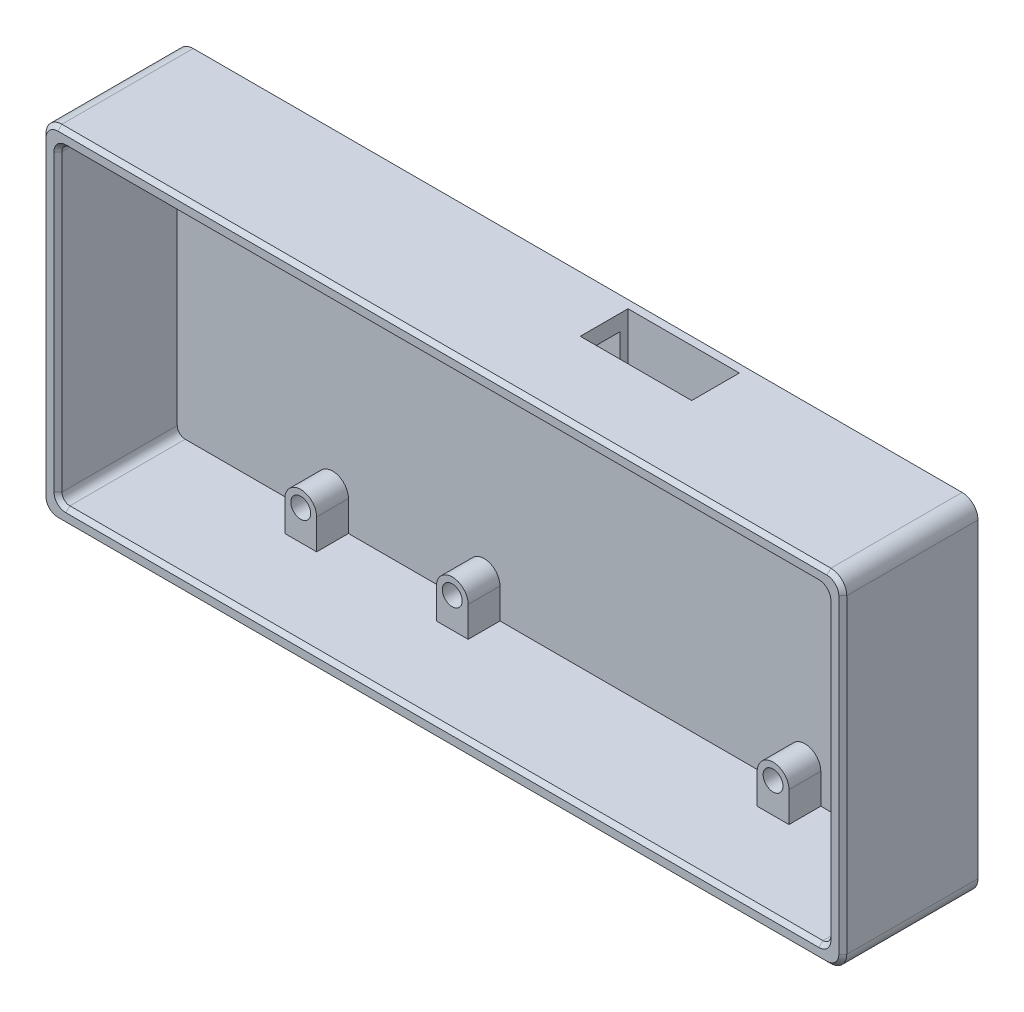
from build123d import *

# Parameters (mm, degrees)
EXTRUDE_1_DEPTH     = 2
SKETCH_2_W          = 10
SKETCH_2_H          = 10
CUT_EXTRUDE_1_DEPTH = 1
EXTRUDE_2_DEPTH     = 15
EXTRUDE_3_DEPTH     = 4
MM_2_D              = 2.5
MM_2_DEPTH          = 4
MM_2_TIP            = 0.751075774
SKETCH_9_W          = 14
SKETCH_9_H          = 6
CUT_EXTRUDE_2_DEPTH = 2
SKETCH_9_2_W        = 14
SKETCH_9_2_H        = 6
CUT_EXTRUDE_3_DEPTH = 10
CHAMFER_1_SIZE      = 0.5


with BuildPart() as part:
    # 草图1 → 凸台-拉伸1 (new body)
    with BuildSketch(Plane.XY):
        with BuildLine():
            Line((2.225416965, 43.522410124), (2.225416965, 4.474270124))
            ThreePointArc((2.225416965, 4.474270124), (2.811203402, 3.060056561), (4.225416965, 2.474270124))
            Line((4.225416965, 2.474270124), (100.900116965, 2.474270124))
            ThreePointArc((100.900116965, 2.474270124), (102.314330527, 3.060056561), (102.900116965, 4.474270124))
            Line((102.900116965, 4.474270124), (102.900116965, 43.522410124))
            ThreePointArc((102.900116965, 43.522410124), (102.314330527, 44.936623686), (100.900116965, 45.522410124))
            Line((100.900116965, 45.522410124), (4.225416965, 45.522410124))
            ThreePointArc((4.225416965, 45.522410124), (2.811203402, 44.936623686), (2.225416965, 43.522410124))
        make_face()
    extrude(amount=EXTRUDE_1_DEPTH)

    # 草图2 → 切除-拉伸1 (cut)
    with BuildSketch(Plane.XY.offset(2)):
        with Locations((66.900116965, 38.523360124)):
            Rectangle(SKETCH_2_W, SKETCH_2_H)
    extrude(amount=-CUT_EXTRUDE_1_DEPTH, mode=Mode.SUBTRACT)

    # 草图3 → 凸台-拉伸2 (add)
    with BuildSketch(Plane.XY.offset(2)):
        with BuildLine():
            Line((100.900116965, 45.522410124), (4.225416965, 45.522410124))
            ThreePointArc((4.225416965, 45.522410124), (2.811203402, 44.936623686), (2.225416965, 43.522410124))
            Line((2.225416965, 43.522410124), (2.225416965, 4.474270124))
            ThreePointArc((2.225416965, 4.474270124), (2.811203402, 3.060056561), (4.225416965, 2.474270124))
            Line((4.225416965, 2.474270124), (100.900116965, 2.474270124))
            ThreePointArc((100.900116965, 2.474270124), (102.314330527, 3.060056561), (102.900116965, 4.474270124))
            Line((102.900116965, 4.474270124), (102.900116965, 43.522410124))
            ThreePointArc((102.900116965, 43.522410124), (102.314330527, 44.936623686), (100.900116965, 45.522410124))
        make_face()
        with BuildLine():
            Line((99.900259554, 43.523360121), (85.135816842, 43.522660124))
            Line((85.135816842, 43.522660124), (81.135817087, 43.522660124))
            Line((81.135817087, 43.522660124), (44.800816842, 43.523360124))
            Line((44.800816842, 43.523360124), (40.800817087, 43.523360124))
            Line((40.800817087, 43.523360124), (25.750866842, 43.523360124))
            Line((25.750866842, 43.523360124), (21.750867087, 43.523360124))
            Line((21.750867087, 43.523360124), (5.225191965, 43.523360124))
            ThreePointArc((5.225191965, 43.523360124), (4.518078599, 43.23046032), (4.225191965, 42.5233415))
            Line((4.225191965, 42.5233415), (4.225881965, 5.474270124))
            ThreePointArc((4.225881965, 5.474270124), (4.518775184, 4.767163343), (5.225881965, 4.474270124))
            Line((5.225881965, 4.474270124), (21.750867087, 4.474270124))
            Line((21.750867087, 4.474270124), (25.750866842, 4.474270124))
            Line((25.750866842, 4.474270124), (40.800817087, 4.474270124))
            Line((40.800817087, 4.474270124), (44.800816842, 4.474270124))
            Line((44.800816842, 4.474270124), (81.135817087, 4.474270124))
            Line((81.135817087, 4.474270124), (85.135816842, 4.474270124))
            Line((85.135816842, 4.474270124), (99.899616965, 4.474270124))
            ThreePointArc((99.899616965, 4.474270124), (100.606717161, 4.767156758), (100.899616964, 5.4742515))
            Line((100.899616964, 5.4742515), (100.900306965, 42.523360124))
            ThreePointArc((100.900306965, 42.523360124), (100.607396983, 43.230483666), (99.900259554, 43.523360121))
        make_face(mode=Mode.SUBTRACT)
    extrude(amount=EXTRUDE_2_DEPTH)

    # 草图4 → 凸台-拉伸3 (add)
    with BuildSketch(Plane.XY.offset(2)):
        with BuildLine():
            Line((21.750867087, 39.723310124), (21.750867087, 43.523360124))
            Line((21.750867087, 43.523360124), (25.750866842, 43.523360124))
            Line((25.750866842, 43.523360124), (25.750866842, 39.722610124))
            ThreePointArc((25.750866842, 39.722610124), (23.750516904, 37.722610216), (21.750867087, 39.723310124))
        make_face()
        with BuildLine():
            Line((40.800817087, 39.722610124), (40.800817087, 43.523360124))
            Line((40.800817087, 43.523360124), (44.800816842, 43.523360124))
            Line((44.800816842, 43.523360124), (44.800816842, 39.721910124))
            ThreePointArc((44.800816842, 39.721910124), (42.800466904, 37.721910216), (40.800817087, 39.722610124))
        make_face()
        with BuildLine():
            Line((81.135817087, 39.722610124), (81.135817087, 43.522660124))
            Line((81.135817087, 43.522660124), (85.135816842, 43.522660124))
            Line((85.135816842, 43.522660124), (85.135816842, 39.721910124))
            ThreePointArc((85.135816842, 39.721910124), (83.135466904, 37.721910216), (81.135817087, 39.722610124))
        make_face()
        with BuildLine():
            Line((21.750867087, 8.273350124), (21.750867087, 4.474270124))
            Line((21.750867087, 4.474270124), (25.750866842, 4.474270124))
            Line((25.750866842, 4.474270124), (25.750866842, 8.272650124))
            ThreePointArc((25.750866842, 8.272650124), (23.751217026, 10.273350032), (21.750867087, 8.273350124))
        make_face()
        with BuildLine():
            Line((40.800817087, 8.272650124), (40.800817087, 4.474270124))
            Line((40.800817087, 4.474270124), (44.800816842, 4.474270124))
            Line((44.800816842, 4.474270124), (44.800816842, 8.271950124))
            ThreePointArc((44.800816842, 8.271950124), (42.801167026, 10.272650032), (40.800817087, 8.272650124))
        make_face()
        with BuildLine():
            Line((81.135817087, 8.273350124), (81.135817087, 4.474270124))
            Line((81.135817087, 4.474270124), (85.135816842, 4.474270124))
            Line((85.135816842, 4.474270124), (85.135816842, 8.272650124))
            ThreePointArc((85.135816842, 8.272650124), (83.136167026, 10.273350032), (81.135817087, 8.273350124))
        make_face()
    extrude(amount=EXTRUDE_3_DEPTH)

    # 大小mm 暗销孔2
    with Locations(Plane(origin=(23.750866904, 39.722610124, 6), x_dir=(1, 0, 0), z_dir=(0, 0, 1))):
        with Locations((0, 0), (19.04995, -0.0007), (59.38495, -0.0007), (59.384950122, -31.44926), (19.049950122, -31.44996), (1.22e-07, -31.44926)):
            Hole(MM_2_D / 2, depth=MM_2_DEPTH)
            with Locations((0, 0, -(MM_2_DEPTH + MM_2_TIP / 2))):  # 118° drill point
                Cone(0, MM_2_D / 2, MM_2_TIP, mode=Mode.SUBTRACT)

    # 草图9 → 切除-拉伸2 (cut)
    with BuildSketch(Plane(origin=(0, 45.522410124, 0), x_dir=(1, 0, 0), z_dir=(0, 1, 0))):
        with Locations((66.900116965, -4)):
            Rectangle(SKETCH_9_W, SKETCH_9_H)
    extrude(amount=-CUT_EXTRUDE_2_DEPTH, mode=Mode.SUBTRACT)

    # 草图9<2> → 切除-拉伸3 (cut)
    with BuildSketch(Plane(origin=(0, 45.522410124, 0), x_dir=(1, 0, 0), z_dir=(0, 1, 0))):
        with Locations((66.900116965, -4)):
            Rectangle(SKETCH_9_2_W, SKETCH_9_2_H)
    extrude(amount=-CUT_EXTRUDE_3_DEPTH, mode=Mode.SUBTRACT)

    # 倒角1
    chamfer_1_edges = [part.edges().sort_by_distance(p)[0] for p in [
        (83.135816965, 43.522660124, 17),
        (62.968316965, 43.523010124, 17),
        (25.013004404, 43.523360124, 17),
        (4.518078599, 43.23046032, 17),
        (4.225536965, 23.998805812, 17),
        (4.518775184, 4.767163343, 17),
        (52.562749465, 4.474270124, 17),
        (100.606717161, 4.767156758, 17),
        (100.899961965, 23.998805812, 17),
        (100.607396983, 43.230483666, 17),
        (92.518038198, 43.523010123, 17),
        (102.900116965, 23.998340124, 17),
        (102.314330527, 3.060056561, 17),
        (52.562766965, 2.474270124, 17),
        (2.811203402, 3.060056561, 17),
        (2.225416965, 23.998340124, 17),
        (2.811203402, 44.936623686, 17),
        (52.562766965, 45.522410124, 17),
        (102.314330527, 44.936623686, 17),
    ]]
    chamfer(chamfer_1_edges, length=CHAMFER_1_SIZE)


solid = part.part
